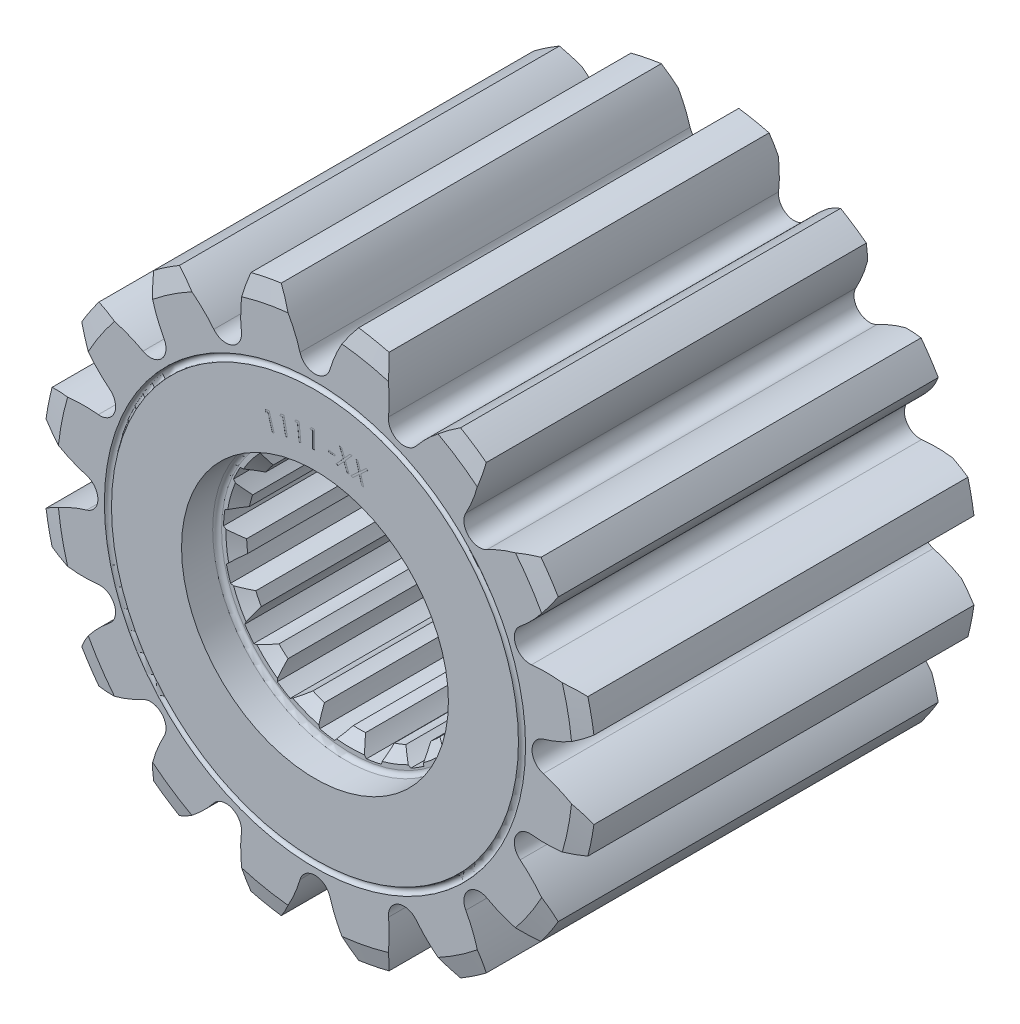
from build123d import *

# Parameters (mm, degrees)
CUT_EXTRUDE1_DEPTH = 63.106702537
CIRPATTERN1_COUNT  = 16
CUT_EXTRUDE2_DEPTH = 62.801274429
CIRPATTERN2_COUNT  = 17
PARTNO_DEPTH       = 0.01


with BuildPart() as part:
    # Sketch2 → Revolve1 (revolve)
    with BuildSketch(Plane(origin=(0, 0, 0), x_dir=(0, 0, -1), z_dir=(1, 0, 0))):
        with BuildLine():
            Line((0, 15), (0, 22.875))
            ThreePointArc((0, 22.875), (-0.4, 23.275), (0, 23.675))
            Line((0, 23.675), (0, 29))
            Line((0, 29), (-0.562693304, 31.1))
            Line((-0.562693304, 31.1), (-43.287306696, 31.1))
            Line((-43.287306696, 31.1), (-43.85, 29))
            Line((-43.85, 29), (-43.85, 23.675))
            ThreePointArc((-43.85, 23.675), (-43.45, 23.275), (-43.85, 22.875))
            Line((-43.85, 22.875), (-43.85, 15))
            Line((-43.85, 15), (-40.35, 15))
            ThreePointArc((-40.35, 15), (-39.996446609, 14.853553391), (-39.85, 14.5))
            Line((-39.85, 14.5), (-39.85, 14))
            Line((-39.85, 14), (-38.85, 12.69))
            Line((-38.85, 12.69), (-5, 12.69))
            Line((-5, 12.69), (-4, 14))
            Line((-4, 14), (-4, 14.5))
            ThreePointArc((-4, 14.5), (-3.853553391, 14.853553391), (-3.5, 15))
            Line((-3.5, 15), (0, 15))
        make_face()
    revolve(axis=Axis((0, 0, 0), (0, 0, 1)))

    # Sketch3 → Cut-Extrude1 (cut, through all)
    with BuildSketch(Plane.XY):
        with BuildLine():
            ThreePointArc((4.35, 30.794277066), (0, 31.1), (-4.35, 30.794277066))
            ThreePointArc((-4.35, 30.794277066), (-2.764629435, 28.35739577), (-1.679111514, 25.660463972))
            ThreePointArc((-1.679111514, 25.660463972), (0, 24.4035), (1.679111514, 25.660463972))
            ThreePointArc((1.679111514, 25.660463972), (2.764629435, 28.35739577), (4.35, 30.794277066))
        make_face()
    cut_extrude1 = extrude(amount=CUT_EXTRUDE1_DEPTH, mode=Mode.SUBTRACT)

    # CirPattern1: Cut-Extrude1 ×16 about axis
    cirpattern1_axis = Axis((0, 0, 5), (0, 0, 1))
    for i in range(1, CIRPATTERN1_COUNT):
        add(cut_extrude1.rotate(cirpattern1_axis, i * 360 / CIRPATTERN1_COUNT), mode=Mode.SUBTRACT)

    # Sketch4 → Cut-Extrude2 (cut, through all)
    with BuildSketch(Plane.XY):
        with BuildLine():
            ThreePointArc((0.85, 14.264697683), (0, 14.29), (-0.85, 14.264697683))
            ThreePointArc((-0.85, 14.264697683), (-1.276543067, 13.436106806), (-1.65, 12.582273245))
            ThreePointArc((-1.65, 12.582273245), (0, 12.69), (1.65, 12.582273245))
            ThreePointArc((1.65, 12.582273245), (1.276543067, 13.436106806), (0.85, 14.264697683))
        make_face()
    cut_extrude2 = extrude(amount=CUT_EXTRUDE2_DEPTH, mode=Mode.SUBTRACT)

    # CirPattern2: Cut-Extrude2 ×17 about axis
    cirpattern2_axis = Axis((0, 0, 5), (0, 0, 1))
    for i in range(1, CIRPATTERN2_COUNT):
        add(cut_extrude2.rotate(cirpattern2_axis, i * 360 / CIRPATTERN2_COUNT), mode=Mode.SUBTRACT)

    # Sketch5 → PARTNO (cut)
    with BuildSketch(Plane.XY.offset(43.85)):
        Polygon((-5.533031144, 18.154784149), (-5.156829221, 18.264159149), (-4.600338837, 16.348694406), (-4.790242683, 16.293405944), (-5.292245888, 18.021370688), (-5.593127298, 17.934030944), align=None)
        Polygon((-3.866754327, 18.575172833), (-3.482940225, 18.649692064), (-3.103533173, 16.697368346), (-3.29744343, 16.65970809), (-3.639590866, 18.420926038), (-3.94608125, 18.361230525), align=None)
        Polygon((-2.175165268, 18.840147343), (-1.787745396, 18.879410163), (-1.587825525, 16.908656958), (-1.783738986, 16.888624907), (-1.964027448, 18.666269138), (-2.27332232, 18.635019138), align=None)
        Polygon((-0.447669625, 18.973453435), (-0.077877958, 18.973453435), (-0.077877958, 16.973453435), (-0.257365138, 16.973453435), (-0.257365138, 18.76832523), (-0.565057446, 18.76832523), align=None)
        Polygon((1.530221511, 17.759171157), (2.267000357, 17.680244875), (2.249772793, 17.516783337), (1.512993947, 17.595709619), align=None)
        Polygon((2.770544005, 18.774686793), (2.998508748, 18.732218844), (3.324229902, 17.883661152), (3.93681003, 18.558340639), (4.162370928, 18.516673972), (3.405960671, 17.678132306), (3.838652979, 16.557138716), (3.610688235, 16.599206024), (3.255319646, 17.512266921), (2.593861312, 16.787907947), (2.365896569, 16.830375895), (3.1747908, 17.721000895), align=None)
        Polygon((4.623794147, 18.415503565), (4.84775248, 18.350199078), (5.088938377, 17.469590104), (5.768425557, 18.082971514), (5.989980044, 18.018468309), (5.149835813, 17.256048437), (5.471149916, 16.092186257), (5.247191582, 16.157090104), (4.983169147, 17.10500677), (4.249595429, 16.447154206), (4.025637095, 16.512058052), (4.923473634, 17.321753565), align=None)
    extrude(amount=-PARTNO_DEPTH, mode=Mode.SUBTRACT)


solid = part.part
